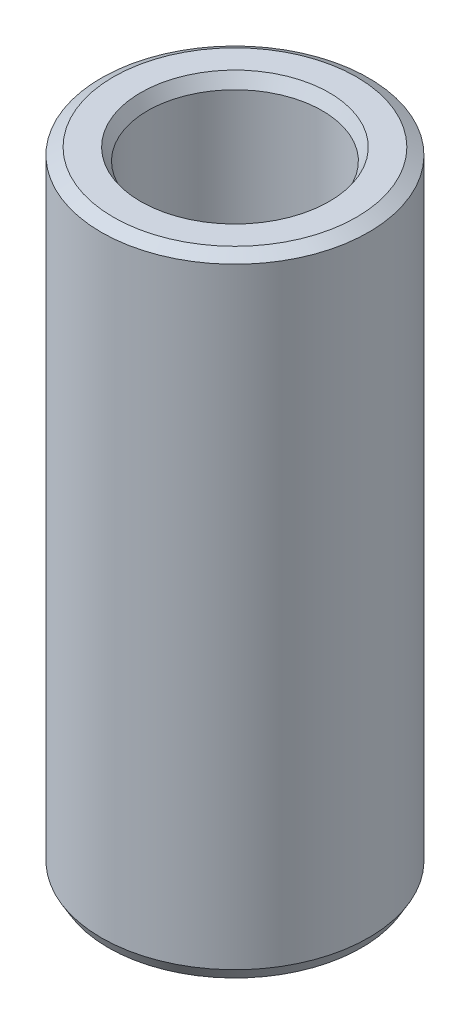
from build123d import *
from OCP.BRepFilletAPI import BRepFilletAPI_MakeChamfer

# Parameters (mm, degrees)
SKETCH1_R           = 10
BOSS_EXTRUDE1_DEPTH = 47.136938273
SKETCH2_R           = 6.533305062
CUT_EXTRUDE1_DEPTH  = 50.212711262
CHAMFER1_SIZE       = 0.522809554
CHAMFER1_SIZE2      = 0.905532711


with BuildPart() as part:
    # Sketch1 → Boss-Extrude1 (new body)
    with BuildSketch(Plane(origin=(0, 0, 0), x_dir=(1, 0, 0), z_dir=(0, 1, 0))):
        Circle(SKETCH1_R)
    extrude(amount=BOSS_EXTRUDE1_DEPTH)

    # Sketch2 → Cut-Extrude1 (cut, through all)
    with BuildSketch(Plane(origin=(0, 0, 0), x_dir=(1, 0, 0), z_dir=(0, 1, 0))):
        Circle(SKETCH2_R)
    extrude(amount=CUT_EXTRUDE1_DEPTH, mode=Mode.SUBTRACT)

    # Chamfer1: one chamfer whose edges measure the first distance from different faces: ONE call of the kernel's chamfer builder (chamfer() names one face for all edges)
    chamfer1_edges_1 = [part.edges().sort_by_distance(p)[0] for p in [
        (-6.533305062, 47.136938273, 0),
    ]]
    chamfer1_side_1 = [part.faces().sort_by_distance(p)[0] for p in [
        (-9.717157288, 47.136938273, 0),
    ]]
    chamfer1_edges_2 = [part.edges().sort_by_distance(p)[0] for p in [
        (-6.533305062, 0, 0),
    ]]
    chamfer1_side_2 = [part.faces().sort_by_distance(p)[0] for p in [
        (-6.533305062, 23.568469136, 0),
    ]]
    chamfer1_edges_3 = [part.edges().sort_by_distance(p)[0] for p in [
        (-10, 0, 0),
    ]]
    chamfer1_side_3 = [part.faces().sort_by_distance(p)[0] for p in [
        (-9.717157288, 0, 0),
    ]]
    chamfer1_edges_4 = [part.edges().sort_by_distance(p)[0] for p in [
        (-10, 47.136938273, 0),
    ]]
    chamfer1_side_4 = [part.faces().sort_by_distance(p)[0] for p in [
        (-10, 23.568469136, 0),
    ]]
    chamfer1 = BRepFilletAPI_MakeChamfer(part.part.solid().wrapped)
    for e in chamfer1_edges_1:
        chamfer1.Add(CHAMFER1_SIZE, CHAMFER1_SIZE2, e.wrapped, chamfer1_side_1[0].wrapped)  # the first distance lies on this face
    for e in chamfer1_edges_2:
        chamfer1.Add(CHAMFER1_SIZE, CHAMFER1_SIZE2, e.wrapped, chamfer1_side_2[0].wrapped)  # the first distance lies on this face
    for e in chamfer1_edges_3:
        chamfer1.Add(CHAMFER1_SIZE, CHAMFER1_SIZE2, e.wrapped, chamfer1_side_3[0].wrapped)  # the first distance lies on this face
    for e in chamfer1_edges_4:
        chamfer1.Add(CHAMFER1_SIZE, CHAMFER1_SIZE2, e.wrapped, chamfer1_side_4[0].wrapped)  # the first distance lies on this face
    add(Compound.cast(chamfer1.Shape()), mode=Mode.REPLACE)


solid = part.part
